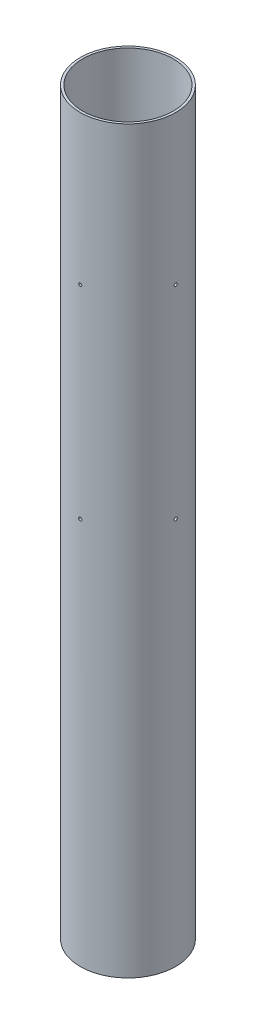
from build123d import *

# Parameters (mm, degrees)
SKETCH1_R                 = 50.8
SKETCH1_R_2               = 48.26
COUPLER_EXTRUSION_DEPTH   = 787.4
BULKHEAD_HOLE_REACH       = 797.551
SKETCH2_R                 = 1.6383
CIRPATTERN1_COUNT         = 4
LOWER_BULKHEAD_HOLE_REACH = 797.551
SKETCH3_R                 = 1.7526
CIRPATTERN2_COUNT         = 4


with BuildPart() as part:
    # Sketch1 → Coupler Extrusion (new body)
    with BuildSketch(Plane(origin=(0, 0, 0), x_dir=(1, 0, 0), z_dir=(0, 1, 0))):
        Circle(SKETCH1_R)
        Circle(SKETCH1_R_2, mode=Mode.SUBTRACT)
    extrude(amount=COUPLER_EXTRUSION_DEPTH)

    # Sketch2 → Bulkhead Hole (cut, up to next)
    with BuildSketch(Plane.XY.offset(50.8), mode=Mode.PRIVATE) as bulkhead_hole_sk1:
        with Locations((0, 628.65)):
            Circle(SKETCH2_R)
    bulkhead_hole_tool1 = extrude(bulkhead_hole_sk1.sketch, amount=-BULKHEAD_HOLE_REACH, mode=Mode.PRIVATE) & part.part
    bulkhead_hole = bulkhead_hole_tool1.solids().sort_by_distance((0, 628.65, 50.8))[0]
    add(bulkhead_hole, mode=Mode.SUBTRACT)

    # CirPattern1: Bulkhead Hole ×4 about axis
    cirpattern1_axis = Axis((0, 787.4, 0), (0, -1, 0))
    for i in range(1, CIRPATTERN1_COUNT):
        add(bulkhead_hole.rotate(cirpattern1_axis, i * 360 / CIRPATTERN1_COUNT), mode=Mode.SUBTRACT)

    # Sketch3 → Lower Bulkhead Hole (cut, up to next)
    with BuildSketch(Plane.XY.offset(50.8), mode=Mode.PRIVATE) as lower_bulkhead_hole_sk1:
        with Locations((0, 412.75)):
            Circle(SKETCH3_R)
    lower_bulkhead_hole_tool1 = extrude(lower_bulkhead_hole_sk1.sketch, amount=-LOWER_BULKHEAD_HOLE_REACH, mode=Mode.PRIVATE) & part.part
    lower_bulkhead_hole = lower_bulkhead_hole_tool1.solids().sort_by_distance((0, 412.75, 50.8))[0]
    add(lower_bulkhead_hole, mode=Mode.SUBTRACT)

    # CirPattern2: Lower Bulkhead Hole ×4 about axis
    cirpattern2_axis = Axis((0, 787.4, 0), (0, -1, 0))
    for i in range(1, CIRPATTERN2_COUNT):
        add(lower_bulkhead_hole.rotate(cirpattern2_axis, i * 360 / CIRPATTERN2_COUNT), mode=Mode.SUBTRACT)


solid = part.part
